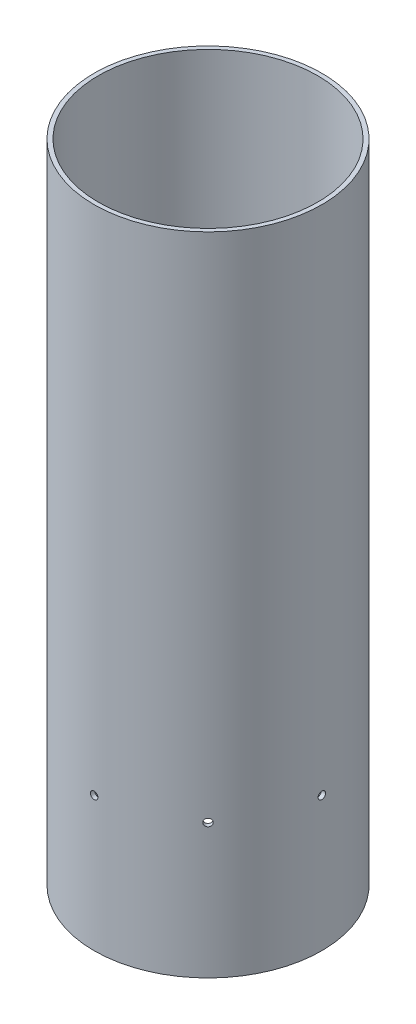
from build123d import *

# Parameters (mm, degrees)
SKETCH1_R           = 53.721
SKETCH1_R_2         = 51.7271
BOSS_EXTRUDE1_DEPTH = 304.8
SKETCH2_R           = 1.7526
CUT_EXTRUDE2_DEPTH  = 127
CIRPATTERN1_COUNT   = 8


with BuildPart() as part:
    # Sketch1 → Boss-Extrude1 (new body)
    with BuildSketch(Plane(origin=(0, 0, 0), x_dir=(1, 0, 0), z_dir=(0, 1, 0))):
        Circle(SKETCH1_R)
        Circle(SKETCH1_R_2, mode=Mode.SUBTRACT)
    extrude(amount=BOSS_EXTRUDE1_DEPTH)

    # Sketch2 → Cut-Extrude2 (cut)
    with BuildSketch(Plane.XY):
        with Locations((0, 63.5)):
            Circle(SKETCH2_R)
    cut_extrude2 = extrude(amount=-CUT_EXTRUDE2_DEPTH, mode=Mode.SUBTRACT)

    # CirPattern1: Cut-Extrude2 ×8 about axis
    cirpattern1_axis = Axis((0, 304.8, 0), (0, -1, 0))
    for i in range(1, CIRPATTERN1_COUNT):
        add(cut_extrude2.rotate(cirpattern1_axis, i * 360 / CIRPATTERN1_COUNT), mode=Mode.SUBTRACT)


solid = part.part
